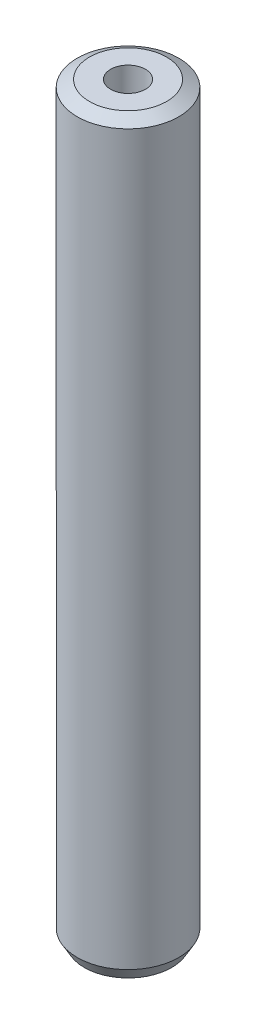
from build123d import *
from OCP.BRepFilletAPI import BRepFilletAPI_MakeChamfer

# Parameters (mm, degrees)
SKETCH1_R           = 22.5
BOSS_EXTRUDE1_DEPTH = 331.005184063
SKETCH2_R           = 7.702517991
CUT_EXTRUDE1_DEPTH  = 333.531099112
CHAMFER1_SIZE       = 3.132641826
CHAMFER1_SIZE2      = 5.425894805


with BuildPart() as part:
    # Sketch1 → Boss-Extrude1 (new body)
    with BuildSketch(Plane(origin=(0, 0, 0), x_dir=(1, 0, 0), z_dir=(0, 1, 0))):
        Circle(SKETCH1_R)
    extrude(amount=BOSS_EXTRUDE1_DEPTH)

    # Sketch2 → Cut-Extrude1 (cut, through all)
    with BuildSketch(Plane(origin=(0, 0, 0), x_dir=(1, 0, 0), z_dir=(0, 1, 0))):
        Circle(SKETCH2_R)
    extrude(amount=CUT_EXTRUDE1_DEPTH, mode=Mode.SUBTRACT)

    # Chamfer1: one chamfer whose edges measure the first distance from different faces: ONE call of the kernel's chamfer builder (chamfer() names one face for all edges)
    chamfer1_edges_1 = [part.edges().sort_by_distance(p)[0] for p in [
        (-22.5, 331.005184063, 0),
    ]]
    chamfer1_side_1 = [part.faces().sort_by_distance(p)[0] for p in [
        (-22.5, 165.502592032, 0),
    ]]
    chamfer1_edges_2 = [part.edges().sort_by_distance(p)[0] for p in [
        (-22.5, 0, 0),
    ]]
    chamfer1_side_2 = [part.faces().sort_by_distance(p)[0] for p in [
        (-21.863603897, 0, 0),
    ]]
    chamfer1 = BRepFilletAPI_MakeChamfer(part.part.solid().wrapped)
    for e in chamfer1_edges_1:
        chamfer1.Add(CHAMFER1_SIZE, CHAMFER1_SIZE2, e.wrapped, chamfer1_side_1[0].wrapped)  # the first distance lies on this face
    for e in chamfer1_edges_2:
        chamfer1.Add(CHAMFER1_SIZE, CHAMFER1_SIZE2, e.wrapped, chamfer1_side_2[0].wrapped)  # the first distance lies on this face
    add(Compound.cast(chamfer1.Shape()), mode=Mode.REPLACE)


solid = part.part
